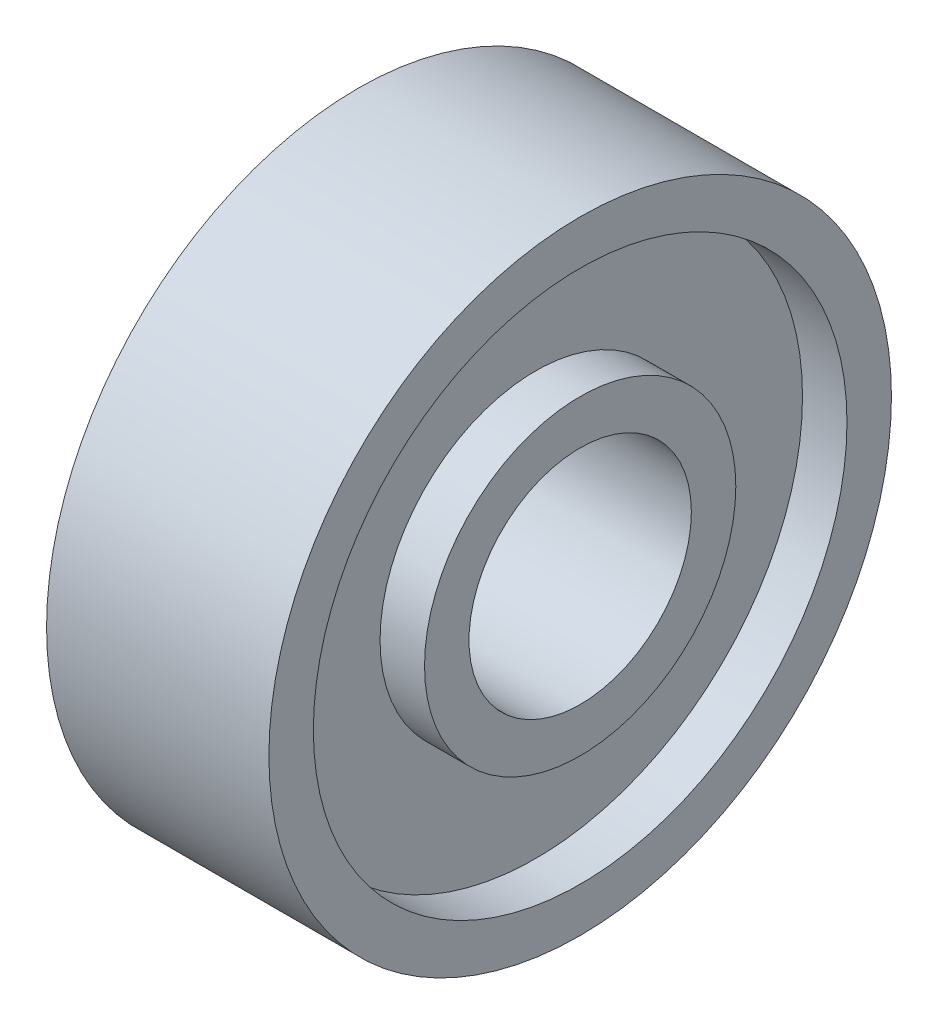
from build123d import *

# Parameters (mm, degrees)
SKETCH_1_R          = 7
SKETCH_1_R_2        = 2.5
EXTRUDE_1_DEPTH     = 2.5
SKETCH_2_R          = 6
SKETCH_2_R_2        = 3.5
CUT_EXTRUDE_1_DEPTH = 1
CUT_EXTRUDE_START   = -1
SKETCH_3_R          = 4.5
SKETCH_3_R_2        = 3.5
CUT_EXTRUDE_2_DEPTH = 1


with BuildPart() as part:
    # 草图1 → 凸台-拉伸1 (new, symmetric)
    with BuildSketch(Plane.YZ):
        Circle(SKETCH_1_R)
        Circle(SKETCH_1_R_2, mode=Mode.SUBTRACT)
    extrude(amount=EXTRUDE_1_DEPTH, both=True)

    # 草图2 → 切除-拉伸1 (cut)
    with BuildSketch(Plane(origin=(2.5, 0, 0), x_dir=(0, 0, -1), z_dir=(1, 0, 0))):
        Circle(SKETCH_2_R)
        Circle(SKETCH_2_R_2, mode=Mode.SUBTRACT)
    extrude(amount=-CUT_EXTRUDE_1_DEPTH, mode=Mode.SUBTRACT)

    # 草图3 → 切除-拉伸2 (cut)
    with BuildSketch(Plane.ZY.offset(2.5).offset(CUT_EXTRUDE_START)):
        Circle(SKETCH_3_R)
        Circle(SKETCH_3_R_2, mode=Mode.SUBTRACT)
    extrude(amount=CUT_EXTRUDE_2_DEPTH, mode=Mode.SUBTRACT)


solid = part.part
